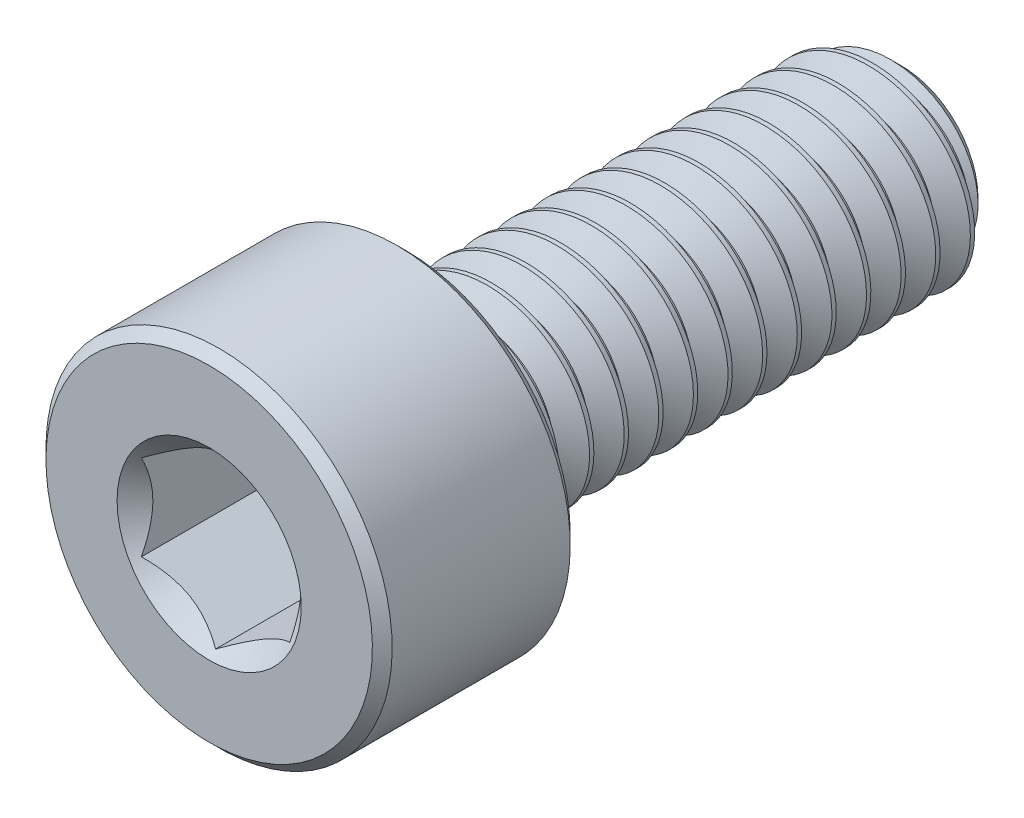
from build123d import *

# Parameters (mm, degrees)
CUT_EXTRUDE1_DEPTH     = 3
SPLIT1_SURFACE_1_BACK  = 18.146
SPLIT1_SURFACE_1_DEPTH = 36.292
SPLIT1_SURFACE_2_BACK  = 18.146
SPLIT1_SURFACE_2_DEPTH = 36.292
CUT_SWEEP1_PITCH       = 0.7


with BuildPart() as part:
    # Sketch2 → Revolve1 (revolve)
    with BuildSketch(Plane(origin=(0, 0, 0), x_dir=(0, 0, -1), z_dir=(1, 0, 0))):
        with BuildLine():
            Line((-7, 0), (-7, 3.3))
            Line((-7, 3.3), (-6.8, 3.5))
            Line((-6.8, 3.5), (-3.2, 3.5))
            Line((-3.2, 3.5), (-3, 3.3))
            Line((-3, 3.3), (-3, 2.2))
            ThreePointArc((-3, 2.2), (-2.941421356, 2.058578644), (-2.8, 2))
            Line((-2.8, 2), (6.545336663, 2))
            Line((6.545336663, 2), (7, 1.545336663))
            Line((7, 1.545336663), (7, 0))
            Line((7, 0), (-7, 0))
        make_face()
    revolve(axis=Axis((0, 0, -7), (0, 0, 1)))

    # Sketch3 → Cut-Extrude1 (cut)
    with BuildSketch(Plane.XY.offset(7)):
        Polygon((1.5, -0.866025404), (1.5, 0.866025404), (0, 1.732050808), (-1.5, 0.866025404), (-1.5, -0.866025404), (0, -1.732050808), align=None)
    extrude(amount=-CUT_EXTRUDE1_DEPTH, mode=Mode.SUBTRACT)

    # Cut-Extrude2 cone 1 section (through the dimple's axis) → Cut-Extrude2 (revolve, cut)
    with BuildSketch(Plane(origin=(0, 0, 7), x_dir=(0, -1, 0), z_dir=(1, 0, 0))):
        Polygon((0, 0), (1.861954618, 0), (0, 1.861954618), align=None)
    revolve(axis=Axis((0, 0, 7), (0, 0, -1)), mode=Mode.SUBTRACT)


with BuildPart() as body_2:
    # Split1: the piece behind the surface
    add(part.part)
    # Split1 surface: a surface, the sketch's curves swept straight by 36.292 mm
    with BuildLine(Plane(origin=(0, 0, 0), x_dir=(0, 0, -1), z_dir=(1, 0, 0)).offset(-SPLIT1_SURFACE_1_BACK), mode=Mode.PRIVATE) as split1_surface_1_path:
        Line((-2.8, -3.5), (-2.8, 3.5))
    split1_surface_1 = Shell.extrude(split1_surface_1_path.wire(), (1 * SPLIT1_SURFACE_1_DEPTH, 0 * SPLIT1_SURFACE_1_DEPTH, 0 * SPLIT1_SURFACE_1_DEPTH))
    split(bisect_by=split1_surface_1, keep=Keep.BOTTOM)

    # Cut-Sweep1: the profile of Sketch7 screwed along a right-hand helix of 15.285714 turns, 6 arcs to a turn; built about Z, then put on its axis
    cut_sweep1_z = Axis((0, 0, 0), (0, 0, 1))
    cut_sweep1_corners = [(2.037888611, 0, 0.021875), (2.037888611, 0, -0.634375), (1.545336663, 0, -0.35), (1.545336663, 0, -0.2625)]
    with BuildLine(mode=Mode.PRIVATE) as cut_sweep1_profile:
        Line(cut_sweep1_corners[0], cut_sweep1_corners[1])
        Line(cut_sweep1_corners[1], cut_sweep1_corners[2])
        Line(cut_sweep1_corners[2], cut_sweep1_corners[3])
        Line(cut_sweep1_corners[3], cut_sweep1_corners[0])
    cut_sweep1_cap = Face(cut_sweep1_profile.wire())
    cut_sweep1_turn_angles = [0, 30, 60, 90, 120, 150, 180, 210, 240, 270, 300, 330, 360]
    cut_sweep1_turn_weights = [1, 0.8660254037844387, 1, 0.8660254037844387, 1, 0.8660254037844387, 1, 0.8660254037844387, 1, 0.8660254037844387, 1, 0.8660254037844387, 1]
    cut_sweep1_turn_rails = [Edge.make_bspline([Vector(p[0], p[1], 0).rotate(cut_sweep1_z, cut_sweep1_turn_angles[k]) / cut_sweep1_turn_weights[k] + Vector(0, 0, p[2] + CUT_SWEEP1_PITCH * cut_sweep1_turn_angles[k] / 360) for k in range(13)], [0, 0, 0, 1, 1, 2, 2, 3, 3, 4, 4, 5, 5, 6, 6, 6], 2, cut_sweep1_turn_weights) for p in cut_sweep1_corners]
    cut_sweep1_turn_sides = [Face.make_surface_from_curves(cut_sweep1_turn_rails[p[0]], cut_sweep1_turn_rails[p[1]]) for p in [(0, 1), (1, 2), (2, 3), (3, 0)]]
    cut_sweep1_last_angles = [5400, 5430, 5460, 5481.428571429, 5502.857142857]
    cut_sweep1_last_weights = [1, 0.8660254037844387, 1, 0.9308737486442353, 1]
    cut_sweep1_last_rails = [Edge.make_bspline([Vector(p[0], p[1], 0).rotate(cut_sweep1_z, cut_sweep1_last_angles[k]) / cut_sweep1_last_weights[k] + Vector(0, 0, p[2] + CUT_SWEEP1_PITCH * cut_sweep1_last_angles[k] / 360) for k in range(5)], [0, 0, 0, 1, 1, 2, 2, 2], 2, cut_sweep1_last_weights) for p in cut_sweep1_corners]
    cut_sweep1_last_sides = [Face.make_surface_from_curves(cut_sweep1_last_rails[p[0]], cut_sweep1_last_rails[p[1]]) for p in [(0, 1), (1, 2), (2, 3), (3, 0)]]
    cut_sweep1 = Plane(origin=(0, 0, -7), x_dir=(0, 1, 0), z_dir=(0, 0, 1)) * Solid(Shell([*[p.moved(Location((0, 0, CUT_SWEEP1_PITCH * i))) for i in range(15) for p in cut_sweep1_turn_sides], *cut_sweep1_last_sides, cut_sweep1_cap, cut_sweep1_cap.rotate(cut_sweep1_z, 5502.857142857).moved(Location((0, 0, CUT_SWEEP1_PITCH * 5502.857142857 / 360)))]))
    add(cut_sweep1, mode=Mode.SUBTRACT)


with BuildPart() as part_1:
    add(part.part)

    # Split1: split by a surface, the side it looks to stays
    # Split1 surface: a surface, the sketch's curves swept straight by 36.292 mm
    with BuildLine(Plane(origin=(0, 0, 0), x_dir=(0, 0, -1), z_dir=(1, 0, 0)).offset(-SPLIT1_SURFACE_2_BACK), mode=Mode.PRIVATE) as split1_surface_2_path:
        Line((-2.8, -3.5), (-2.8, 3.5))
    split1_surface_2 = Shell.extrude(split1_surface_2_path.wire(), (1 * SPLIT1_SURFACE_2_DEPTH, 0 * SPLIT1_SURFACE_2_DEPTH, 0 * SPLIT1_SURFACE_2_DEPTH))
    split(bisect_by=split1_surface_2, keep=Keep.TOP)

    add(body_2.part)  # Revolve2 merges body 2
    # Sketch8 → Revolve2 (revolve)
    with BuildSketch(Plane(origin=(0, 0, 0), x_dir=(0, 0, -1), z_dir=(1, 0, 0)), mode=Mode.PRIVATE) as revolve2_sk:
        Polygon((-3, 0), (-3, 2), (-2.8, 2), (-1.645299462, 0), align=None)
    revolve(revolve2_sk.sketch.rotate(Axis((0, 0, 1.645299462), (0, 0, 1)), 270), axis=Axis((0, 0, 1.645299462), (0, 0, 1)))


solid = part_1.part
